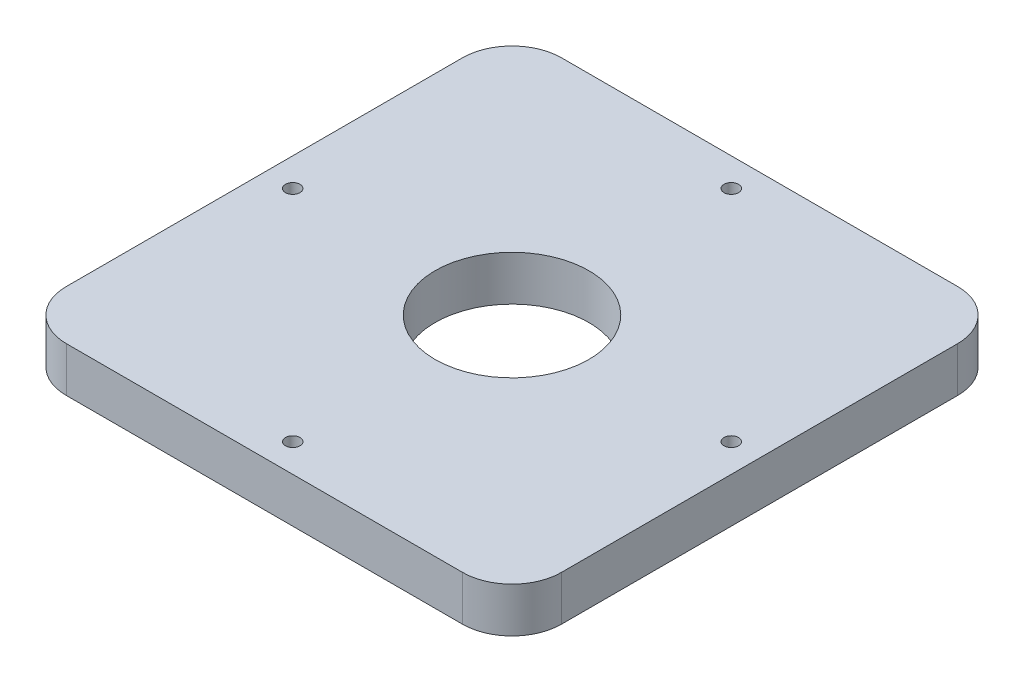
from build123d import *

# Parameters (mm, degrees)
BOSS_EXTRUDE1_DEPTH = 6.35
SKETCH2_R           = 10.875
SKETCH2_R_2         = 1.025
CUT_EXTRUDE1_DEPTH  = 6.35


with BuildPart() as part:
    # Sketch1 → Boss-Extrude1 (new body)
    with BuildSketch(Plane(origin=(0, 0, 0), x_dir=(1, 0, 0), z_dir=(0, 1, 0))):
        with BuildLine():
            Line((7, 0), (63, 0))
            ThreePointArc((63, 0), (67.949747468, 2.050252532), (70, 7))
            Line((70, 7), (70, 63))
            ThreePointArc((70, 63), (67.949747468, 67.949747468), (63, 70))
            Line((63, 70), (7, 70))
            ThreePointArc((7, 70), (2.050252532, 67.949747468), (0, 63))
            Line((0, 63), (0, 7))
            ThreePointArc((0, 7), (2.050252532, 2.050252532), (7, 0))
        make_face()
    extrude(amount=BOSS_EXTRUDE1_DEPTH)

    # Sketch2 → Cut-Extrude1 (cut)
    with BuildSketch(Plane(origin=(0, 6.35, 0), x_dir=(1, 0, 0), z_dir=(0, 1, 0))):
        with Locations((35, 35)):
            Circle(SKETCH2_R)
        with Locations((35, 66)):
            Circle(SKETCH2_R_2)
        with Locations((35, 4)):
            Circle(SKETCH2_R_2)
        with Locations((4, 35)):
            Circle(SKETCH2_R_2)
        with Locations((66, 35)):
            Circle(SKETCH2_R_2)
    extrude(amount=-CUT_EXTRUDE1_DEPTH, mode=Mode.SUBTRACT)


solid = part.part
